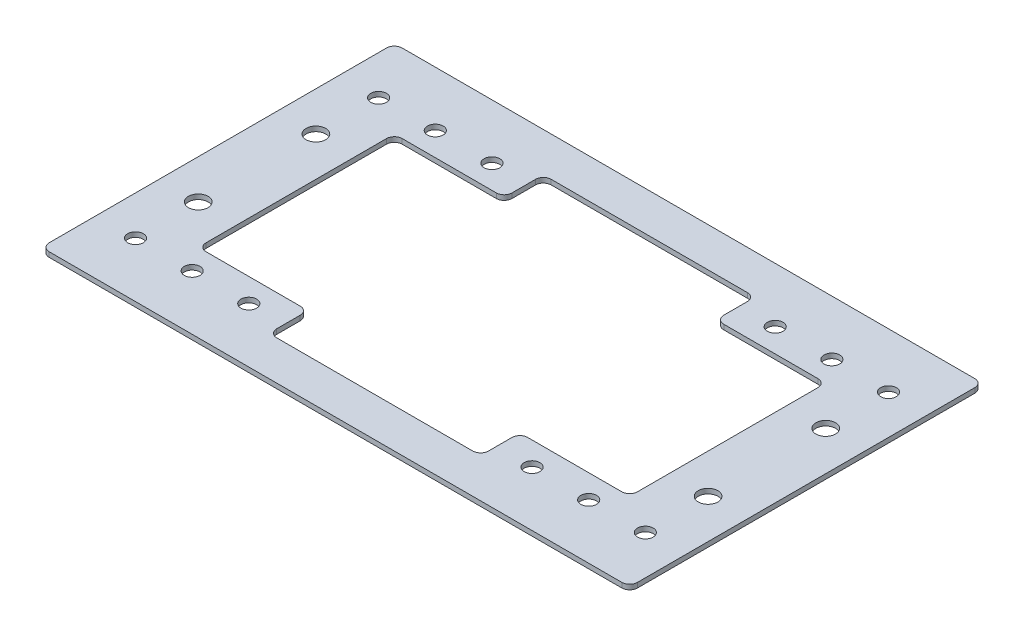
from build123d import *

# Parameters (mm, degrees)
SKETCH1_W           = 190.5
SKETCH1_H           = 114.3
BOSS_EXTRUDE1_DEPTH = 1.5875
SKETCH6_W           = 139.7
SKETCH6_H           = 63.5
CUT_EXTRUDE1_DEPTH  = 3.175
FILLET1_R           = 2.54
SKETCH7_R           = 3.175
CUT_EXTRUDE2_DEPTH  = 3.175
SKETCH8_R           = 2.54
CUT_EXTRUDE3_DEPTH  = 2.54
SKETCH9_R           = 2.54
CUT_EXTRUDE4_DEPTH  = 2.54
SKETCH10_W          = 68.58
SKETCH10_H          = 12.7
CUT_EXTRUDE5_DEPTH  = 112.090976934
FILLET2_R           = 2.54


with BuildPart() as part:
    # Sketch1 → Boss-Extrude1 (new body)
    with BuildSketch(Plane(origin=(0, 0, 0), x_dir=(1, 0, 0), z_dir=(0, 1, 0))):
        Rectangle(SKETCH1_W, SKETCH1_H)
    extrude(amount=BOSS_EXTRUDE1_DEPTH)

    # Sketch6 → Cut-Extrude1 (cut)
    with BuildSketch(Plane(origin=(0, 1.5875, 0), x_dir=(1, 0, 0), z_dir=(0, 1, 0))):
        Rectangle(SKETCH6_W, SKETCH6_H)
    extrude(amount=-CUT_EXTRUDE1_DEPTH, mode=Mode.SUBTRACT)

    # Fillet1
    fillet1_edges = [part.edges().sort_by_distance(p)[0] for p in [
        (-69.85, 0.79375, 31.75),
        (-69.85, 0.79375, -31.75),
        (69.85, 0.79375, -31.75),
        (69.85, 0.79375, 31.75),
        (95.25, 0.79375, -57.15),
        (95.25, 0.79375, 57.15),
        (-95.25, 0.79375, 57.15),
        (-95.25, 0.79375, -57.15),
    ]]
    fillet(fillet1_edges, radius=FILLET1_R)

    # Sketch7 → Cut-Extrude2 (cut)
    with BuildSketch(Plane(origin=(0, 1.5875, 0), x_dir=(1, 0, 0), z_dir=(0, 1, 0))):
        with Locations(Location((-82.55, 19.05, 0), (0, 0, 270))):
            Circle(SKETCH7_R)
        with Locations(Location((-82.55, -19.05, 0), (0, 0, 270))):
            Circle(SKETCH7_R)
        with Locations(Location((82.55, -19.05, 0), (0, 0, 270))):
            Circle(SKETCH7_R)
        with Locations(Location((82.55, 19.05, 0), (0, 0, 270))):
            Circle(SKETCH7_R)
    extrude(amount=-CUT_EXTRUDE2_DEPTH, mode=Mode.SUBTRACT)

    # Sketch8 → Cut-Extrude3 (cut)
    with BuildSketch(Plane(origin=(0, 1.5875, 0), x_dir=(1, 0, 0), z_dir=(0, 1, 0))):
        with Locations(Location((82.55, 39.37, 0), (0, 0, 270))):
            Circle(SKETCH8_R)
        with Locations(Location((64.205555556, 39.37, 0), (0, 0, 270))):
            Circle(SKETCH8_R)
        with Locations(Location((45.861111111, 39.37, 0), (0, 0, 270))):
            Circle(SKETCH8_R)
        with Locations(Location((27.516666667, 39.37, 0), (0, 0, 270))):
            Circle(SKETCH8_R)
        with Locations(Location((9.172222222, 39.37, 0), (0, 0, 270))):
            Circle(SKETCH8_R)
        with Locations(Location((-9.172222222, 39.37, 0), (0, 0, 270))):
            Circle(SKETCH8_R)
        with Locations(Location((-27.516666667, 39.37, 0), (0, 0, 270))):
            Circle(SKETCH8_R)
        with Locations(Location((-45.861111111, 39.37, 0), (0, 0, 270))):
            Circle(SKETCH8_R)
        with Locations(Location((-64.205555556, 39.37, 0), (0, 0, 270))):
            Circle(SKETCH8_R)
        with Locations(Location((-82.55, 39.37, 0), (0, 0, 270))):
            Circle(SKETCH8_R)
    extrude(amount=-CUT_EXTRUDE3_DEPTH, mode=Mode.SUBTRACT)

    # Sketch9 → Cut-Extrude4 (cut)
    with BuildSketch(Plane(origin=(0, 1.5875, 0), x_dir=(1, 0, 0), z_dir=(0, 1, 0))):
        with Locations(Location((82.55, -39.37, 0), (0, 0, 270))):
            Circle(SKETCH9_R)
        with Locations(Location((64.205555556, -39.37, 0), (0, 0, 270))):
            Circle(SKETCH9_R)
        with Locations(Location((45.861111111, -39.37, 0), (0, 0, 270))):
            Circle(SKETCH9_R)
        with Locations(Location((27.516666667, -39.37, 0), (0, 0, 270))):
            Circle(SKETCH9_R)
        with Locations(Location((9.172222222, -39.37, 0), (0, 0, 270))):
            Circle(SKETCH9_R)
        with Locations(Location((-9.172222222, -39.37, 0), (0, 0, 270))):
            Circle(SKETCH9_R)
        with Locations(Location((-27.516666667, -39.37, 0), (0, 0, 270))):
            Circle(SKETCH9_R)
        with Locations(Location((-45.861111111, -39.37, 0), (0, 0, 270))):
            Circle(SKETCH9_R)
        with Locations(Location((-64.205555556, -39.37, 0), (0, 0, 270))):
            Circle(SKETCH9_R)
        with Locations(Location((-82.55, -39.37, 0), (0, 0, 270))):
            Circle(SKETCH9_R)
    extrude(amount=-CUT_EXTRUDE4_DEPTH, mode=Mode.SUBTRACT)

    # Sketch10 → Cut-Extrude5 (cut, through all)
    with BuildSketch(Plane(origin=(0, 1.5875, 0), x_dir=(1, 0, 0), z_dir=(0, 1, 0))):
        with Locations((0, -38.1)):
            Rectangle(SKETCH10_W, SKETCH10_H)
        with Locations((0, 38.1)):
            Rectangle(SKETCH10_W, SKETCH10_H)
    extrude(amount=-CUT_EXTRUDE5_DEPTH, mode=Mode.SUBTRACT)

    # Fillet2
    fillet2_edges = [part.edges().sort_by_distance(p)[0] for p in [
        (-34.29, 0.79375, 44.45),
        (-34.29, 0.79375, 31.75),
        (34.29, 0.79375, 31.75),
        (34.29, 0.79375, 44.45),
        (-34.29, 0.79375, -31.75),
        (-34.29, 0.79375, -44.45),
        (34.29, 0.79375, -44.45),
        (34.29, 0.79375, -31.75),
    ]]
    fillet(fillet2_edges, radius=FILLET2_R)


solid = part.part
